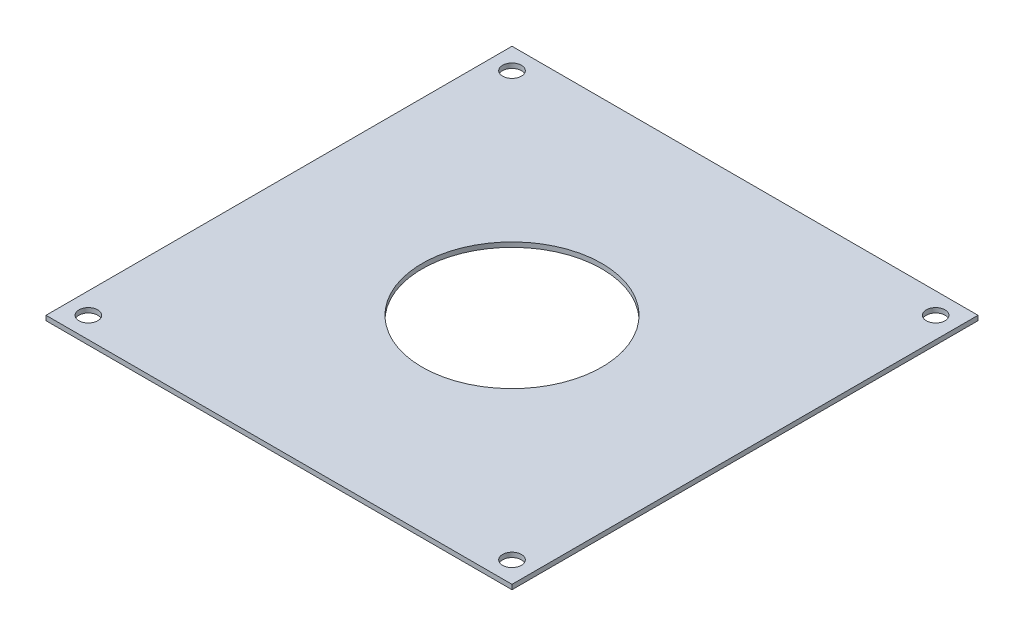
from build123d import *

# Parameters (mm, degrees)
SKETCH1_W           = 98.782817332
SKETCH1_H           = 98.782817332
BOSS_EXTRUDE1_DEPTH = 1.000000032
SKETCH3_R           = 2.000000064
CUT_EXTRUDE2_DEPTH  = 70.85715783
SKETCH4_R           = 19.05
CUT_EXTRUDE3_DEPTH  = 70.85715783


with BuildPart() as part:
    # Sketch1 → Boss-Extrude1 (new body)
    with BuildSketch(Plane(origin=(0, 0, 0), x_dir=(1, 0, 0), z_dir=(0, 1, 0))):
        Rectangle(SKETCH1_W, SKETCH1_H)
    extrude(amount=BOSS_EXTRUDE1_DEPTH)

    # Sketch3 → Cut-Extrude2 (cut, through all)
    with BuildSketch(Plane(origin=(0, 0, 0), x_dir=(1, 0, 0), z_dir=(0, 1, 0))):
        with Locations((44.901280605, 44.901280605)):
            Circle(SKETCH3_R)
        with Locations((44.901280605, -44.901280605)):
            Circle(SKETCH3_R)
        with Locations((-44.901280605, -44.901280605)):
            Circle(SKETCH3_R)
        with Locations((-44.901280605, 44.901280605)):
            Circle(SKETCH3_R)
    extrude(amount=CUT_EXTRUDE2_DEPTH, mode=Mode.SUBTRACT)

    # Sketch4 → Cut-Extrude3 (cut, through all)
    with BuildSketch(Plane(origin=(0, 0, 0), x_dir=(1, 0, 0), z_dir=(0, 1, 0))):
        Circle(SKETCH4_R)
    extrude(amount=CUT_EXTRUDE3_DEPTH, mode=Mode.SUBTRACT)


solid = part.part
